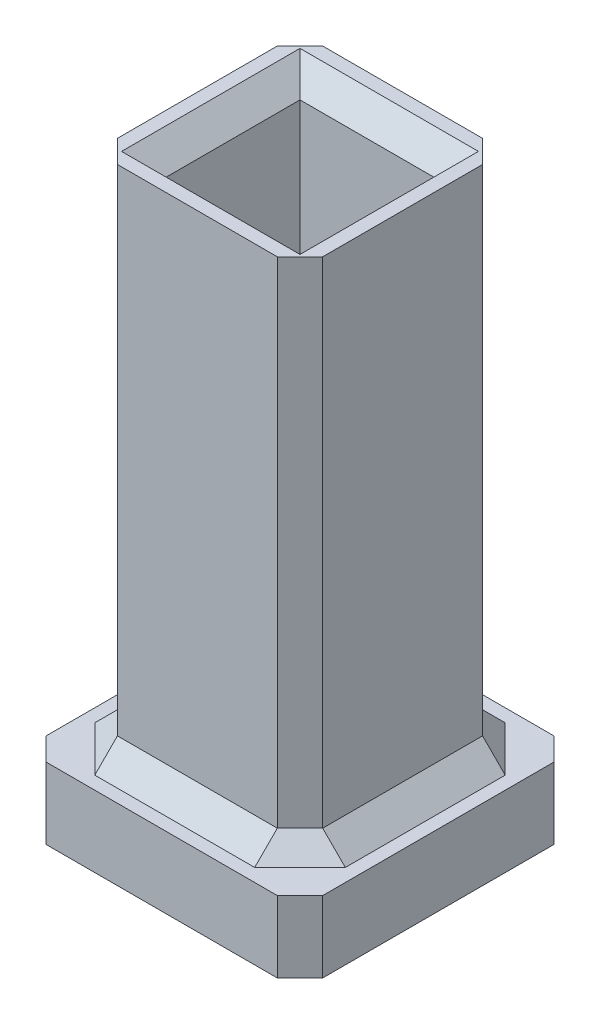
from build123d import *

# Parameters (mm, degrees)
SKETCH1_W           = 23
SKETCH1_H           = 23
SKETCH1_W_2         = 15
SKETCH1_H_2         = 15
BOSS_EXTRUDE1_DEPTH = 66
CHAMFER1_SIZE       = 2.5
SKETCH3_W           = 31
SKETCH3_H           = 31
SKETCH3_W_2         = 23
SKETCH3_H_2         = 23
BOSS_EXTRUDE2_DEPTH = 8
CHAMFER3_SIZE       = 2.54


with BuildPart() as part:
    # Sketch1 → Boss-Extrude1 (new body)
    with BuildSketch(Plane(origin=(0, 0, 0), x_dir=(1, 0, 0), z_dir=(0, 1, 0))):
        Rectangle(SKETCH1_W, SKETCH1_H)
        Rectangle(SKETCH1_W_2, SKETCH1_H_2, mode=Mode.SUBTRACT)
    extrude(amount=BOSS_EXTRUDE1_DEPTH)

    # Chamfer1
    chamfer1_edges = [part.edges().sort_by_distance(p)[0] for p in [
        (0, 66, -7.5),
        (-7.5, 66, 0),
        (0, 66, 7.5),
        (7.5, 66, 0),
    ]]
    chamfer(chamfer1_edges, length=CHAMFER1_SIZE)

    # Sketch3 → Boss-Extrude2 (add)
    with BuildSketch(Plane.XZ):
        Rectangle(SKETCH3_W, SKETCH3_H)
        Rectangle(SKETCH3_W_2, SKETCH3_H_2, mode=Mode.SUBTRACT)
    extrude(amount=-BOSS_EXTRUDE2_DEPTH)

    # Chamfer3
    chamfer3_edges = [part.edges().sort_by_distance(p)[0] for p in [
        (-11.5, 37, -11.5),
        (11.5, 37, -11.5),
        (11.5, 37, 11.5),
        (-11.5, 37, 11.5),
        (-11.5, 8, 0),
        (11.5, 8, 0),
        (-15.5, 4, -15.5),
        (15.5, 4, -15.5),
        (15.5, 4, 15.5),
        (-15.5, 4, 15.5),
        (0, 8, -11.5),
        (0, 8, 11.5),
    ]]
    chamfer(chamfer3_edges, length=CHAMFER3_SIZE)


solid = part.part
